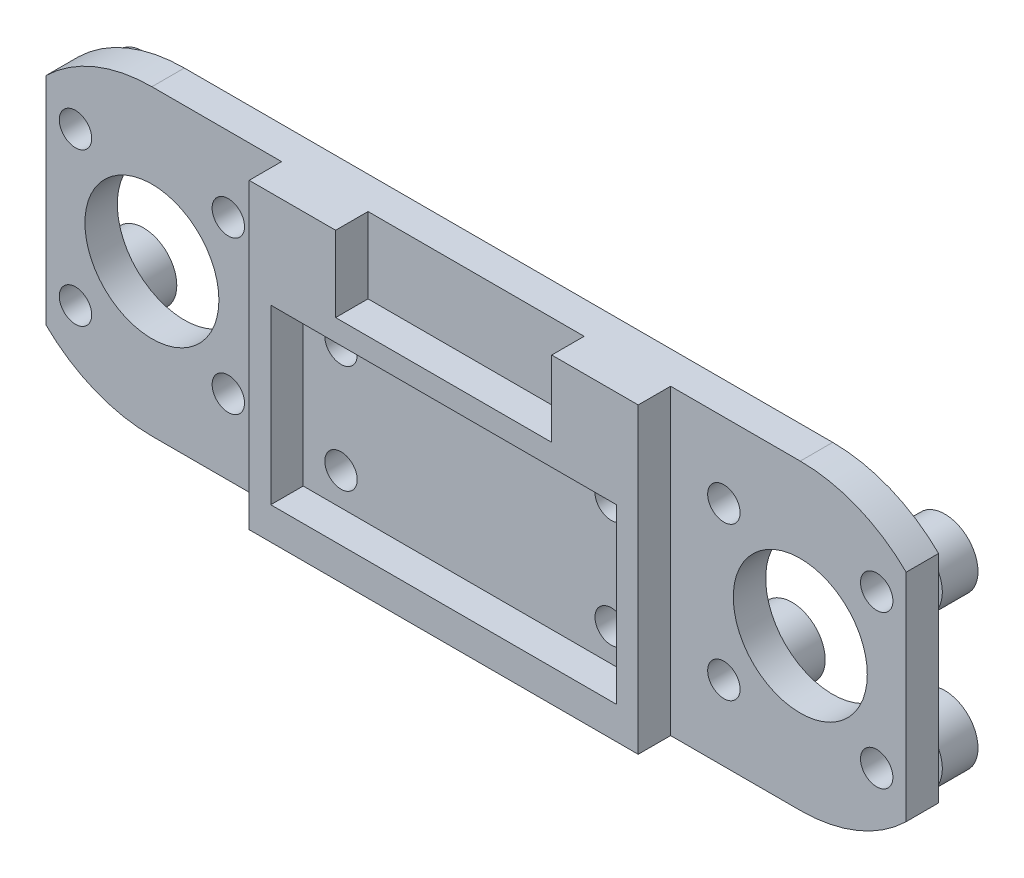
from build123d import *

# Parameters (mm, degrees)
SKETCH1_R              = 6.2
MAIN_DEPTH             = 1.5
SKETCH2_W              = 32
SKETCH2_H              = 16
FRAMEWORK_DEPTH        = 3
SKETCH3_R              = 1.5
FIXHOLE_DEPTH          = 43.615020826
HOLEPATTERN_COUNT      = 2
HOLEPATTERN_PITCH      = 25
HOLEPATTERN_COUNT_DIR2 = 2
HOLEPATTERN_PITCH_DIR2 = 10
SKETCH4_R              = 3.075
SKETCH4_R_2            = 1.5
FORLMK6UU_DEPTH        = 3.3
SKETCH5_R              = 1.5
CUT_EXTRUDE1_DEPTH     = 43.98135364


with BuildPart() as part:
    # Sketch1 → Main (new, symmetric)
    with BuildSketch(Plane.XY):
        with BuildLine():
            Line((-39.8, 9.9979998), (-39.8, -9.9979998))
            ThreePointArc((-39.8, -9.9979998), (-35.292825465, -12.96094127), (-30, -14))
            Line((-30, -14), (30, -14))
            ThreePointArc((30, -14), (35.292825465, -12.96094127), (39.8, -9.9979998))
            Line((39.8, -9.9979998), (39.8, 9.9979998))
            ThreePointArc((39.8, 9.9979998), (35.292825465, 12.96094127), (30, 14))
            Line((30, 14), (-30, 14))
            ThreePointArc((-30, 14), (-35.292825465, 12.96094127), (-39.8, 9.9979998))
        make_face()
        with Locations((-30, 0)):
            Circle(SKETCH1_R, mode=Mode.SUBTRACT)
        with Locations((30, 0)):
            Circle(SKETCH1_R, mode=Mode.SUBTRACT)
    extrude(amount=MAIN_DEPTH, both=True)

    # Sketch2 → Framework (add)
    with BuildSketch(Plane(origin=(0, 0, 1.5), x_dir=(-1, 0, 0), z_dir=(0, 0, -1))):
        Polygon((18, 14), (10, 14), (10, 7), (-10, 7), (-10, 14), (-18, 14), (-18, -14), (18, -14), align=None)
        with Locations((0, -3)):
            Rectangle(SKETCH2_W, SKETCH2_H, mode=Mode.SUBTRACT)
    extrude(amount=-FRAMEWORK_DEPTH)

    # Sketch3 → FixHole (cut, through all)
    with BuildSketch(Plane(origin=(0, 0, -1.5), x_dir=(-1, 0, 0), z_dir=(0, 0, -1))):
        with Locations((12.5, -8)):
            Circle(SKETCH3_R)
    fixhole = extrude(amount=-FIXHOLE_DEPTH, mode=Mode.SUBTRACT)

    # HolePattern: FixHole 2 × 2
    with Locations(*[(i * HOLEPATTERN_PITCH, j * HOLEPATTERN_PITCH_DIR2, 0) for i in range(HOLEPATTERN_COUNT) for j in range(HOLEPATTERN_COUNT_DIR2) if (i, j) != (0, 0)]):
        add(fixhole, mode=Mode.SUBTRACT)

    # Sketch4 → ForLMK6UU (add)
    # profile 1 of 4: a face of its own
    with BuildSketch(Plane.XY.offset(-1.5)):
        with Locations((-37.071067812, 7.071067812)):
            Circle(SKETCH4_R)
        with Locations((-37.071067812, 7.071067812)):
            Circle(SKETCH4_R_2, mode=Mode.SUBTRACT)
    # profile 2 of 4: a face of its own
    with BuildSketch(Plane.XY.offset(-1.5)):
        with Locations((-22.928932188, -7.071067812)):
            Circle(SKETCH4_R)
        with Locations((-22.928932188, -7.071067812)):
            Circle(SKETCH4_R_2, mode=Mode.SUBTRACT)
    # profile 3 of 4: a face of its own
    with BuildSketch(Plane.XY.offset(-1.5)):
        with Locations((-22.928932188, 7.071067812)):
            Circle(SKETCH4_R)
        with Locations((-22.928932188, 7.071067812)):
            Circle(SKETCH4_R_2, mode=Mode.SUBTRACT)
    # profile 4 of 4: a face of its own
    with BuildSketch(Plane.XY.offset(-1.5)):
        with Locations((-37.071067812, -7.071067812)):
            Circle(SKETCH4_R)
        with Locations((-37.071067812, -7.071067812)):
            Circle(SKETCH4_R_2, mode=Mode.SUBTRACT)
    forlmk6uu = extrude(amount=-FORLMK6UU_DEPTH)

    # Sketch5 → Cut-Extrude1 (cut, through all)
    with BuildSketch(Plane.XY.offset(1.5)):
        with Locations((-37.071067812, 7.071067812)):
            Circle(SKETCH5_R)
        with Locations((-22.928932188, 7.071067812)):
            Circle(SKETCH5_R)
        with Locations((-37.071067812, -7.071067812)):
            Circle(SKETCH5_R)
        with Locations((-22.928932188, -7.071067812)):
            Circle(SKETCH5_R)
    cut_extrude1 = extrude(amount=-CUT_EXTRUDE1_DEPTH, mode=Mode.SUBTRACT)

    # Mirror1: ForLMK6UU, Cut-Extrude1 across plane
    add(forlmk6uu.mirror(Plane(origin=(0, 0, 0), x_dir=(0, 0, 1), z_dir=(1, 0, 0))))
    add(cut_extrude1.mirror(Plane(origin=(0, 0, 0), x_dir=(0, 0, 1), z_dir=(1, 0, 0))), mode=Mode.SUBTRACT)


solid = part.part
